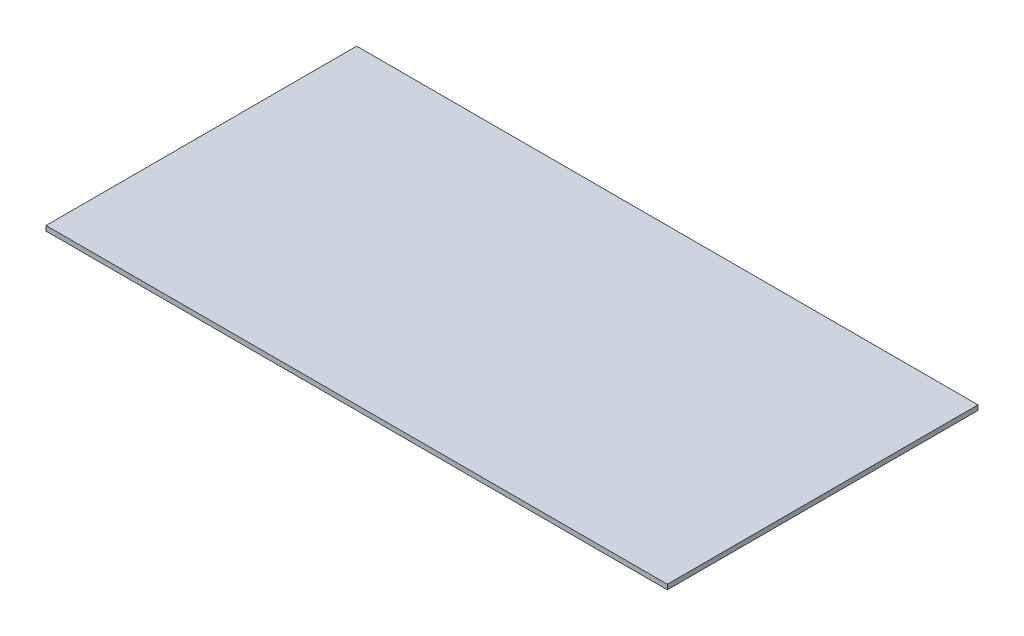
from build123d import *

# Parameters (mm, degrees)
BOSS_EXTRUDE1_DEPTH      = 9.525
BOSS_EXTRUDE1_DEPTH_BACK = 9.525
SKETCH2_W                = 2438.4
SKETCH2_H                = 1219.2


with BuildPart() as part:
    # Sketch2 → Boss-Extrude1 (new, two sides: drawn at the far end of the back side and taken through both)
    with BuildSketch(Plane(origin=(0, 0, 0), x_dir=(1, 0, 0), z_dir=(0, 1, 0)).offset(-BOSS_EXTRUDE1_DEPTH_BACK)):
        Rectangle(SKETCH2_W, SKETCH2_H)
    extrude(amount=BOSS_EXTRUDE1_DEPTH + BOSS_EXTRUDE1_DEPTH_BACK)


solid = part.part
